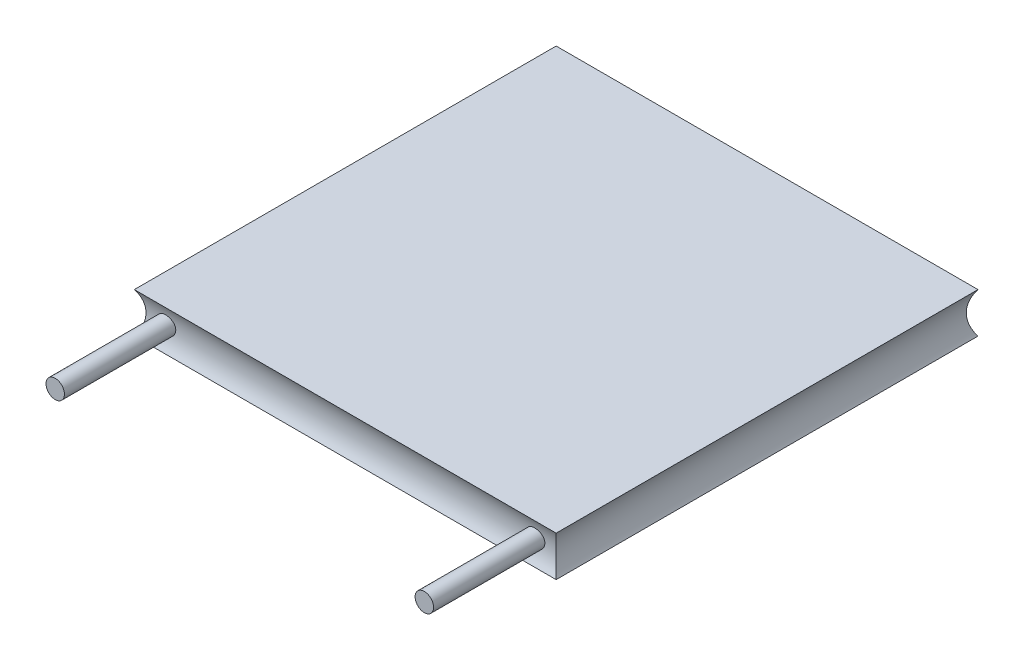
from build123d import *

# Parameters (mm, degrees)
SKETCH1_W                = 40
SKETCH1_H                = 40
BOSS_EXTRUDE1_DEPTH      = 3.82
CUT_EXTRUDE2_DEPTH       = 57.697375601
CUT_EXTRUDE5_DEPTH       = 45
BOSS_EXTRUDE2_DEPTH      = 10
BOSS_EXTRUDE2_DEPTH_BACK = 5
SKETCH4_R                = 0.875
BOSS_EXTRUDE3_DEPTH      = 10
BOSS_EXTRUDE3_DEPTH_BACK = 5
SKETCH5_R                = 0.875


with BuildPart() as part:
    # Sketch1 → Boss-Extrude1 (new body)
    with BuildSketch(Plane(origin=(0, 0, 0), x_dir=(1, 0, 0), z_dir=(0, 1, 0))):
        with Locations((20, 20)):
            Rectangle(SKETCH1_W, SKETCH1_H)
    extrude(amount=BOSS_EXTRUDE1_DEPTH)

    # Sketch2 → Cut-Extrude2 (cut, through all)
    with BuildSketch(Plane.XY):
        with BuildLine():
            Line((-3, 1.91), (0, 0))
            ThreePointArc((0, 0), (0.556416736, 1.91), (0, 3.82))
            Line((0, 3.82), (-3, 1.91))
        make_face()
        with BuildLine():
            Line((43, 1.91), (40, 3.82))
            ThreePointArc((40, 3.82), (39.443583264, 1.91), (40, 0))
            Line((40, 0), (43, 1.91))
        make_face()
    extrude(amount=-CUT_EXTRUDE2_DEPTH, mode=Mode.SUBTRACT)

    # Sketch3 → Cut-Extrude5 (cut)
    with BuildSketch(Plane(origin=(0, 0, 0), x_dir=(0, 0, -1), z_dir=(1, 0, 0))):
        with BuildLine():
            Line((43, 1.91), (40, 3.82))
            ThreePointArc((40, 3.82), (39.443583264, 1.91), (40, 0))
            Line((40, 0), (43, 1.91))
        make_face()
        with BuildLine():
            ThreePointArc((0, 0), (0.556416736, 1.91), (0, 3.82))
            Line((0, 3.82), (-3, 1.91))
            Line((-3, 1.91), (0, 0))
        make_face()
    extrude(amount=CUT_EXTRUDE5_DEPTH, mode=Mode.SUBTRACT)

    # Sketch4 → Boss-Extrude2 (add, two sides: drawn at the far end of the back side and taken through both)
    with BuildSketch(Plane.XY.offset(-BOSS_EXTRUDE2_DEPTH_BACK)):
        with Locations((2.5, 1.91)):
            Circle(SKETCH4_R)
    extrude(amount=BOSS_EXTRUDE2_DEPTH + BOSS_EXTRUDE2_DEPTH_BACK)

    # Sketch5 → Boss-Extrude3 (add, two sides: drawn at the far end of the back side and taken through both)
    with BuildSketch(Plane.XY.offset(-BOSS_EXTRUDE3_DEPTH_BACK)):
        with Locations((37.5, 1.91)):
            Circle(SKETCH5_R)
    extrude(amount=BOSS_EXTRUDE3_DEPTH + BOSS_EXTRUDE3_DEPTH_BACK)


solid = part.part
